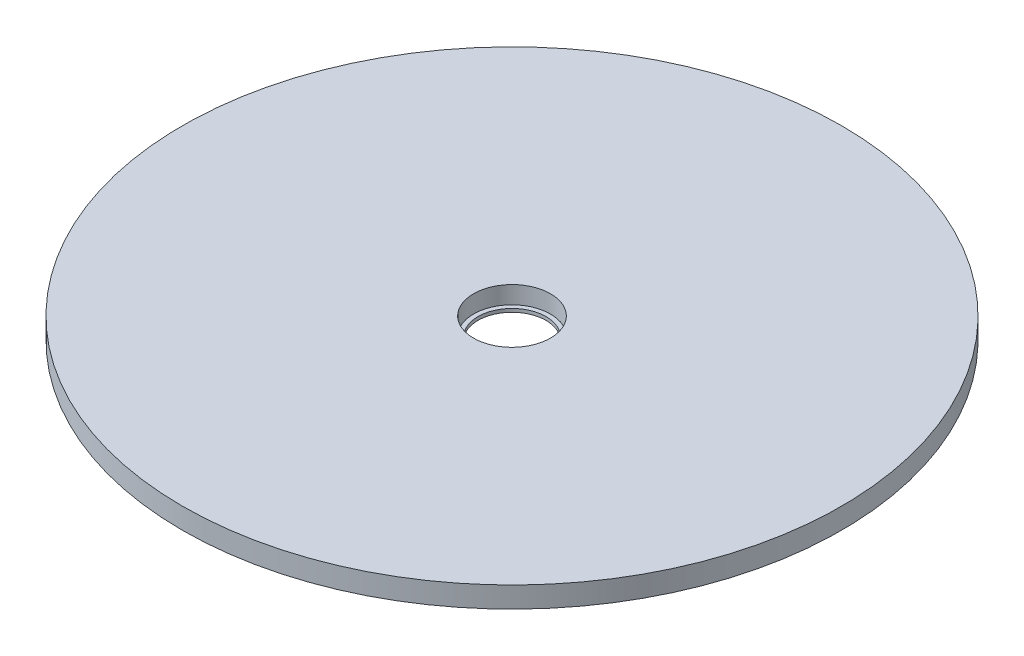
from build123d import *

# Parameters (mm, degrees)
SKETCH1_R           = 150
BOSS_EXTRUDE1_DEPTH = 9.52
SKETCH2_R           = 15.5
CUT_EXTRUDE1_DEPTH  = 213.345544808
SKETCH3_R           = 17.505
CUT_EXTRUDE2_DEPTH  = 8


with BuildPart() as part:
    # Sketch1 → Boss-Extrude1 (new body)
    with BuildSketch(Plane(origin=(0, 0, 0), x_dir=(1, 0, 0), z_dir=(0, 1, 0))):
        Circle(SKETCH1_R)
    extrude(amount=BOSS_EXTRUDE1_DEPTH)

    # Sketch2 → Cut-Extrude1 (cut, through all)
    with BuildSketch(Plane(origin=(0, 9.52, 0), x_dir=(1, 0, 0), z_dir=(0, 1, 0))):
        Circle(SKETCH2_R)
    extrude(amount=-CUT_EXTRUDE1_DEPTH, mode=Mode.SUBTRACT)

    # Sketch3 → Cut-Extrude2 (cut)
    with BuildSketch(Plane(origin=(0, 9.52, 0), x_dir=(1, 0, 0), z_dir=(0, 1, 0))):
        Circle(SKETCH3_R)
    extrude(amount=-CUT_EXTRUDE2_DEPTH, mode=Mode.SUBTRACT)


solid = part.part
